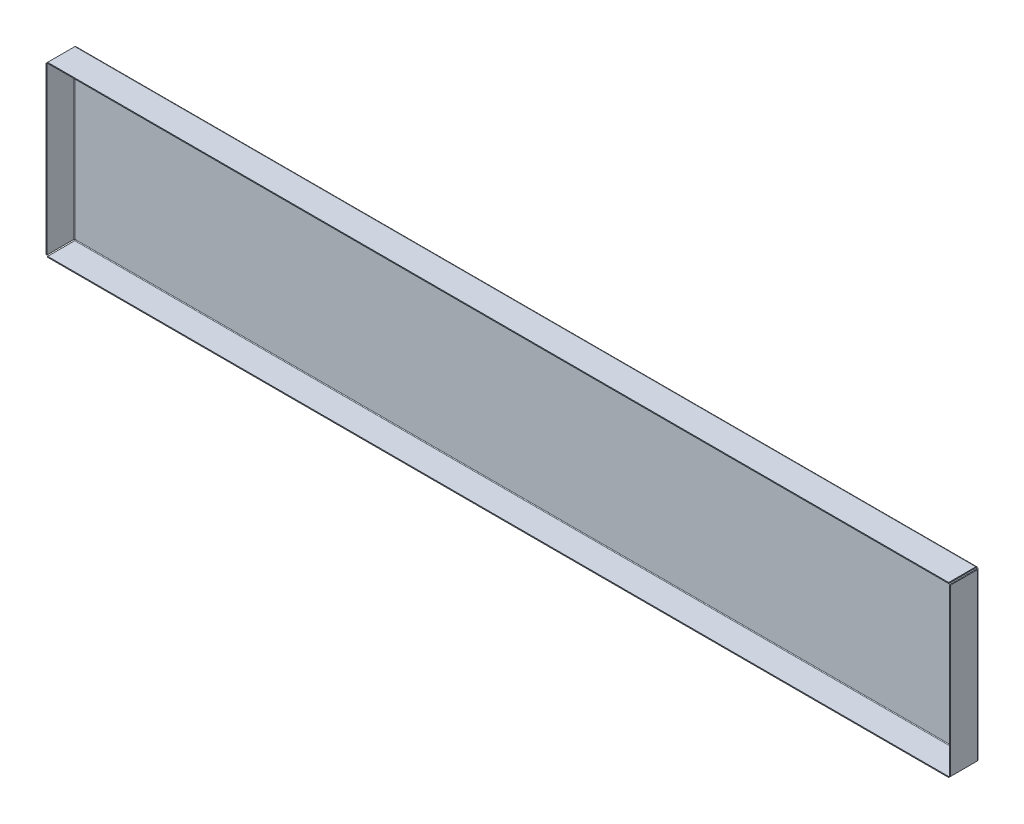
from build123d import *

# Parameters (mm, degrees)
BASE_FLANGE1_DEPTH         = 1
SKETCHED_START             = 31
SKETCHED_BEND1_DEPTH       = 178
SKETCHED_BEND1_2_DEPTH     = 968
SKETCHED_BEND1_3_OUTLINE_W = 968
SKETCHED_BEND1_3_OUTLINE_H = 1
SKETCHED_BEND1_3_DEPTH     = 29.234623369
SKETCHED_START_2           = 210.765376631
SKETCHED_BEND1_4_OUTLINE_W = 968
SKETCHED_BEND1_4_OUTLINE_H = 1
SKETCHED_BEND1_4_DEPTH     = 29.234623369
SKETCHED_BEND1_5_DEPTH     = 178
SKETCHED_BEND1_6_DEPTH     = 968
SKETCHED_BEND1_7_OUTLINE_W = 178
SKETCHED_BEND1_7_OUTLINE_H = 1
SKETCHED_BEND1_7_DEPTH     = 29.234623369
SKETCHED_START_3           = 1000.765376631
SKETCHED_BEND1_8_OUTLINE_W = 178
SKETCHED_BEND1_8_OUTLINE_H = 1
SKETCHED_BEND1_8_DEPTH     = 29.234623369


# Read off the part's stored shape, not the designer's step: Sketched Bend1
# Sheet-metal steps are written as plain solids
with BuildPart() as part:
    # Sketch1 → Base-Flange1 (new body)
    with BuildSketch(Plane.XY):
        Polygon((0, 209), (31, 209), (31, 240), (999, 240), (999, 209), (1030, 209), (1030, 31), (999, 31), (999, 0), (31, 0), (31, 31), (0, 31), align=None)
    extrude(amount=-BASE_FLANGE1_DEPTH)

    # Sketched Bend1 outline → Sketched Bend1 (add)
    with BuildSketch(Plane(origin=(0, 0, 0), x_dir=(1, 0, 0), z_dir=(0, 1, 0)).offset(SKETCHED_START)):
        with BuildLine():
            Line((29.234623369, -0.7366), (29.234623369, -29.765376631))
            Line((29.234623369, -29.765376631), (30.234623369, -29.765376631))
            Line((30.234623369, -29.765376631), (30.234623369, -0.7366))
            ThreePointArc((30.234623369, -0.7366), (30.450368514, -0.215745145), (30.971223369, 0))
            Line((30.971223369, 0), (29.398582279, 0))
            ThreePointArc((29.398582279, 0), (29.276108612, -0.359286442), (29.234623369, -0.7366))
        make_face()
        with BuildLine():
            Line((1000.601417721, 0), (999.028776631, 0))
            ThreePointArc((999.028776631, 0), (999.549631486, -0.215745145), (999.765376631, -0.7366))
            Line((999.765376631, -0.7366), (999.765376631, -29.765376631))
            Line((999.765376631, -29.765376631), (1000.765376631, -29.765376631))
            Line((1000.765376631, -29.765376631), (1000.765376631, -0.7366))
            ThreePointArc((1000.765376631, -0.7366), (1000.723891388, -0.359286442), (1000.601417721, 0))
        make_face()
    extrude(amount=SKETCHED_BEND1_DEPTH)

    # Sketched Bend1 2 outline → Sketched Bend1 2 (add)
    with BuildSketch(Plane.YZ.offset(SKETCHED_START)):
        with BuildLine():
            Line((209.028776631, 0), (210.601417721, 0))
            ThreePointArc((210.601417721, 0), (210.723891388, 0.359286442), (210.765376631, 0.7366))
            Line((210.765376631, 0.7366), (210.765376631, 29.765376631))
            Line((210.765376631, 29.765376631), (209.765376631, 29.765376631))
            Line((209.765376631, 29.765376631), (209.765376631, 0.7366))
            ThreePointArc((209.765376631, 0.7366), (209.549631486, 0.215745145), (209.028776631, 0))
        make_face()
        with BuildLine():
            ThreePointArc((29.234623369, 0.7366), (29.276108612, 0.359286442), (29.398582279, 0))
            Line((29.398582279, 0), (30.971223369, 0))
            ThreePointArc((30.971223369, 0), (30.450368514, 0.215745145), (30.234623369, 0.7366))
            Line((30.234623369, 0.7366), (30.234623369, 29.765376631))
            Line((30.234623369, 29.765376631), (29.234623369, 29.765376631))
            Line((29.234623369, 29.765376631), (29.234623369, 0.7366))
        make_face()
    extrude(amount=SKETCHED_BEND1_2_DEPTH)

    # Sketched Bend1 3 outline → Sketched Bend1 3 (cut)
    with BuildSketch(Plane(origin=(0, 0, 0), x_dir=(1, 0, 0), z_dir=(0, 1, 0))):
        with Locations((515, 0.5)):
            Rectangle(SKETCHED_BEND1_3_OUTLINE_W, SKETCHED_BEND1_3_OUTLINE_H)
    extrude(amount=SKETCHED_BEND1_3_DEPTH, mode=Mode.SUBTRACT)

    # Sketched Bend1 4 outline → Sketched Bend1 4 (cut)
    with BuildSketch(Plane(origin=(0, 0, 0), x_dir=(1, 0, 0), z_dir=(0, 1, 0)).offset(SKETCHED_START_2)):
        with Locations((515, 0.5)):
            Rectangle(SKETCHED_BEND1_4_OUTLINE_W, SKETCHED_BEND1_4_OUTLINE_H)
    extrude(amount=SKETCHED_BEND1_4_DEPTH, mode=Mode.SUBTRACT)

    # Sketched Bend1 5 outline → Sketched Bend1 5 (cut)
    with BuildSketch(Plane(origin=(0, 0, 0), x_dir=(1, 0, 0), z_dir=(0, 1, 0)).offset(SKETCHED_START)):
        with BuildLine():
            Line((0, 0), (29.398582279, 0))
            ThreePointArc((29.398582279, 0), (30.039397205, 0.728828115), (30.971223369, 1))
            Line((30.971223369, 1), (0, 1))
            Line((0, 1), (0, 0))
        make_face()
        with BuildLine():
            Line((1030, 1), (999.028776631, 1))
            ThreePointArc((999.028776631, 1), (999.960602795, 0.728828115), (1000.601417721, 0))
            Line((1000.601417721, 0), (1030, 0))
            Line((1030, 0), (1030, 1))
        make_face()
    extrude(amount=SKETCHED_BEND1_5_DEPTH, mode=Mode.SUBTRACT)

    # Sketched Bend1 6 outline → Sketched Bend1 6 (cut)
    with BuildSketch(Plane.YZ.offset(SKETCHED_START)):
        with BuildLine():
            ThreePointArc((210.601417721, 0), (209.960602795, -0.728828115), (209.028776631, -1))
            Line((209.028776631, -1), (240, -1))
            Line((240, -1), (240, 0))
            Line((240, 0), (210.601417721, 0))
        make_face()
        with BuildLine():
            Line((0, -1), (30.971223369, -1))
            ThreePointArc((30.971223369, -1), (30.039397205, -0.728828115), (29.398582279, 0))
            Line((29.398582279, 0), (0, 0))
            Line((0, 0), (0, -1))
        make_face()
    extrude(amount=SKETCHED_BEND1_6_DEPTH, mode=Mode.SUBTRACT)

    # Sketched Bend1 7 outline → Sketched Bend1 7 (cut)
    with BuildSketch(Plane.YZ):
        with Locations((120, -0.5)):
            Rectangle(SKETCHED_BEND1_7_OUTLINE_W, SKETCHED_BEND1_7_OUTLINE_H)
    extrude(amount=SKETCHED_BEND1_7_DEPTH, mode=Mode.SUBTRACT)

    # Sketched Bend1 8 outline → Sketched Bend1 8 (cut)
    with BuildSketch(Plane.YZ.offset(SKETCHED_START_3)):
        with Locations((120, -0.5)):
            Rectangle(SKETCHED_BEND1_8_OUTLINE_W, SKETCHED_BEND1_8_OUTLINE_H)
    extrude(amount=SKETCHED_BEND1_8_DEPTH, mode=Mode.SUBTRACT)


solid = part.part
